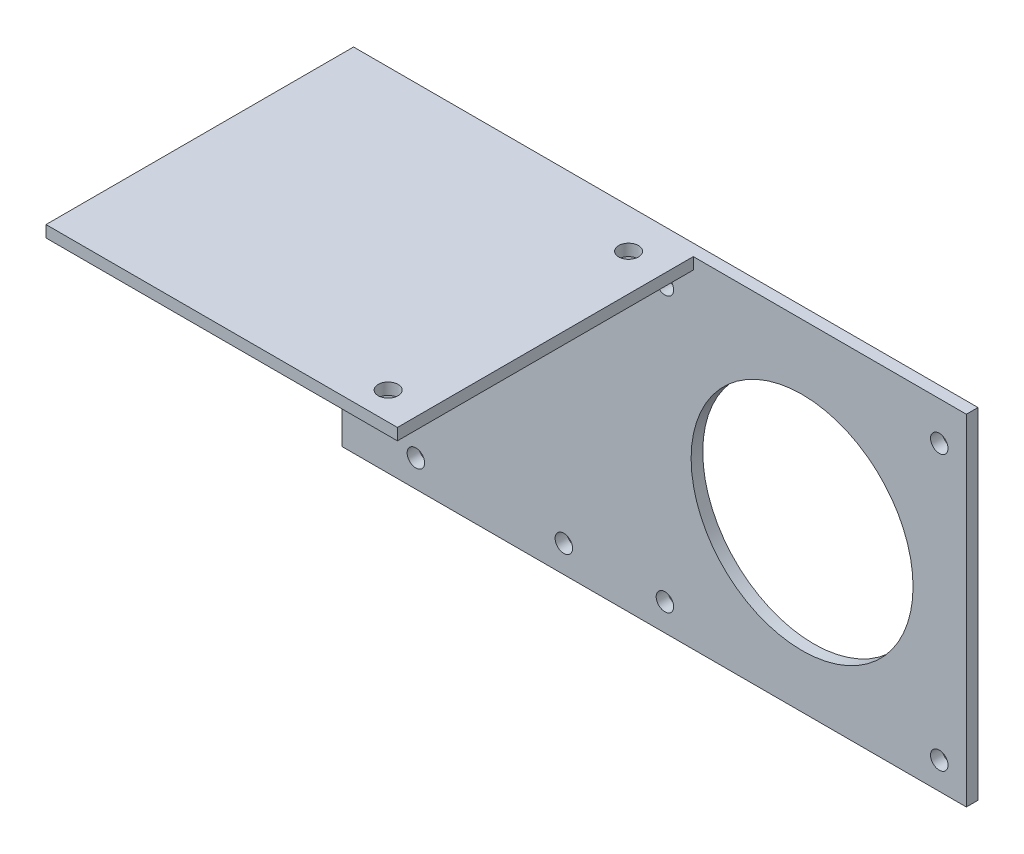
from build123d import *

# Parameters (mm, degrees)
SKETCH1_W           = 107.2
SKETCH1_H           = 58.4
SKETCH1_R           = 1.5
SKETCH1_R_2         = 19.05
BOSS_EXTRUDE1_DEPTH = 2
SKETCH2_W           = 60.325
SKETCH2_H           = 2
BOSS_EXTRUDE2_DEPTH = 52.8
SKETCH3_R           = 1.7
CUT_EXTRUDE1_DEPTH  = 133.22344724


with BuildPart() as part:
    # Sketch1 → Boss-Extrude1 (new body)
    with BuildSketch(Plane.XY):
        with Locations((53.6, 29.2)):
            Rectangle(SKETCH1_W, SKETCH1_H)
        with Locations((102.55, 51.75)):
            Circle(SKETCH1_R, mode=Mode.SUBTRACT)
        with Locations((102.55, 4.65)):
            Circle(SKETCH1_R, mode=Mode.SUBTRACT)
        with Locations((55.45, 4.65)):
            Circle(SKETCH1_R, mode=Mode.SUBTRACT)
        with Locations((55.45, 51.75)):
            Circle(SKETCH1_R, mode=Mode.SUBTRACT)
        with Locations((12.7, 51.75)):
            Circle(SKETCH1_R, mode=Mode.SUBTRACT)
        with Locations((38.1, 51.75)):
            Circle(SKETCH1_R, mode=Mode.SUBTRACT)
        with Locations((12.7, 4.65)):
            Circle(SKETCH1_R, mode=Mode.SUBTRACT)
        with Locations((38.1, 4.65)):
            Circle(SKETCH1_R, mode=Mode.SUBTRACT)
        with Locations((79, 28.2)):
            Circle(SKETCH1_R_2, mode=Mode.SUBTRACT)
    extrude(amount=-BOSS_EXTRUDE1_DEPTH)

    # Sketch2 → Boss-Extrude2 (add)
    with BuildSketch(Plane(origin=(0, 0, -2), x_dir=(-1, 0, 0), z_dir=(0, 0, -1))):
        with Locations((-30.1625, 57.4)):
            Rectangle(SKETCH2_W, SKETCH2_H)
    extrude(amount=-BOSS_EXTRUDE2_DEPTH)

    # Sketch3 → Cut-Extrude1 (cut, through all)
    with BuildSketch(Plane(origin=(0, 58.4, 0), x_dir=(1, 0, 0), z_dir=(0, 1, 0))):
        with Locations((53.975, -4.7625)):
            Circle(SKETCH3_R)
        with Locations((53.975, -46.0375)):
            Circle(SKETCH3_R)
    extrude(amount=-CUT_EXTRUDE1_DEPTH, mode=Mode.SUBTRACT)


solid = part.part
